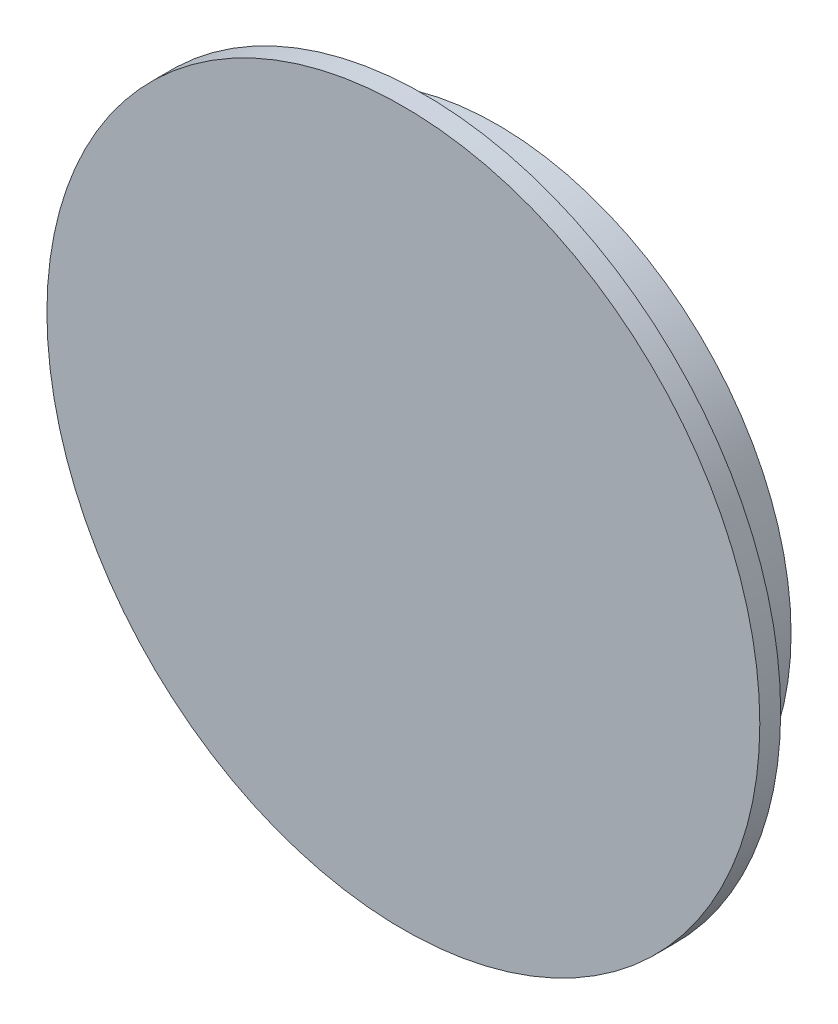
from build123d import *

# Parameters (mm, degrees)
SKETCH1_R           = 14.1
SKETCH1_R_2         = 12.6
BOSS_EXTRUDE1_DEPTH = 3.5
SKETCH2_R           = 17.1
BOSS_EXTRUDE2_DEPTH = 1


with BuildPart() as part:
    # Sketch1 → Boss-Extrude1 (new body)
    with BuildSketch(Plane.XY):
        Circle(SKETCH1_R)
        Circle(SKETCH1_R_2, mode=Mode.SUBTRACT)
    extrude(amount=BOSS_EXTRUDE1_DEPTH)

    # Sketch2 → Boss-Extrude2 (add)
    with BuildSketch(Plane.XY.offset(3.5)):
        Circle(SKETCH2_R)
    extrude(amount=BOSS_EXTRUDE2_DEPTH)


solid = part.part
